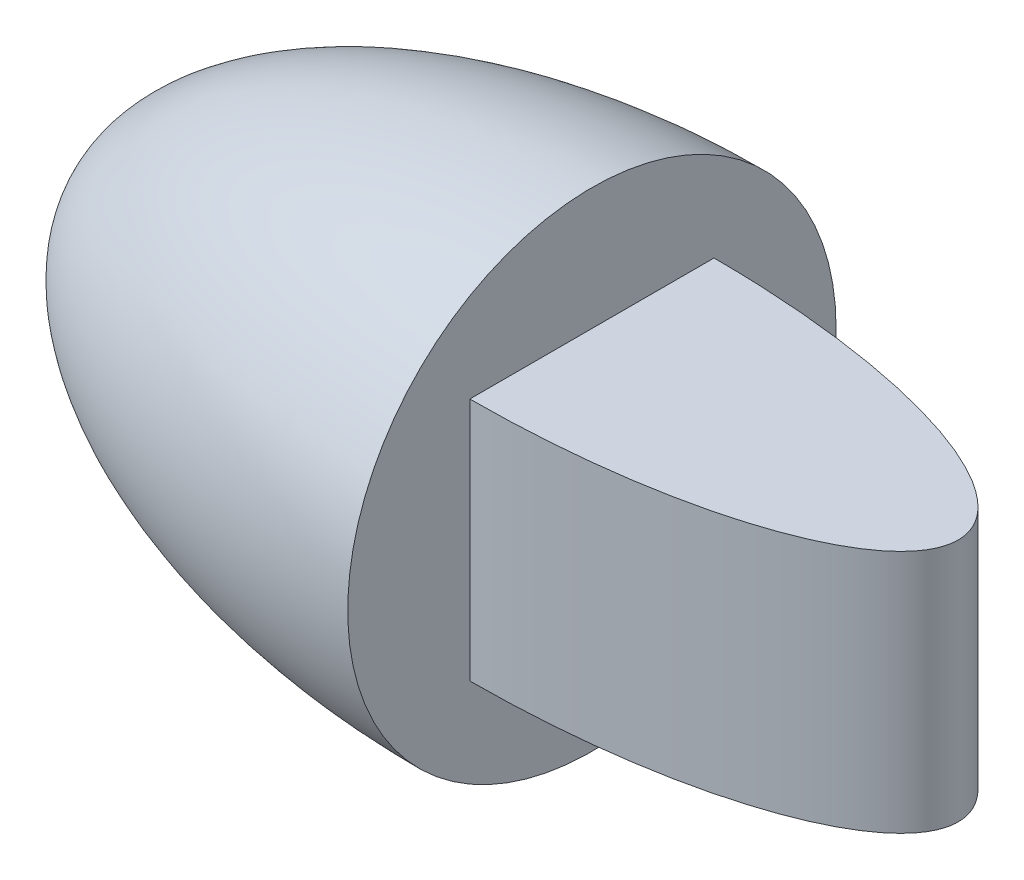
from build123d import *

# Parameters (mm, degrees)
BOSS_EXTRUDE1_DEPTH      = 25
BOSS_EXTRUDE1_DEPTH_BACK = 25
SKETCH1_RX               = 75
SKETCH1_RY               = 25


with BuildPart() as part:
    # Sketch1 → Boss-Extrude1 (new, two sides: drawn at the far end of the back side and taken through both)
    with BuildSketch(Plane(origin=(0, 0, 0), x_dir=(1, 0, 0), z_dir=(0, 1, 0)).offset(-BOSS_EXTRUDE1_DEPTH_BACK)):
        with Locations((0, 0)):
            Ellipse(SKETCH1_RX, SKETCH1_RY)
    extrude(amount=BOSS_EXTRUDE1_DEPTH + BOSS_EXTRUDE1_DEPTH_BACK)

    # Sketch3 → Revolve1 (revolve)
    with BuildSketch(Plane(origin=(0, 0, 0), x_dir=(1, 0, 0), z_dir=(0, 1, 0))):
        with BuildLine():
            Line((0, 0), (-100, 0))
            add(Edge.make_bspline(
                [(0, 50), (-100, 50), (-100, 0)],
                knots=[4.71238898, 4.71238898, 4.71238898, 6.283185307, 6.283185307, 6.283185307], degree=2, weights=[1, 0.707106781, 1]))
            Line((0, 50), (0, 0))
        make_face()
    revolve(axis=Axis((0, 0, 0), (-1, 0, 0)))


solid = part.part
